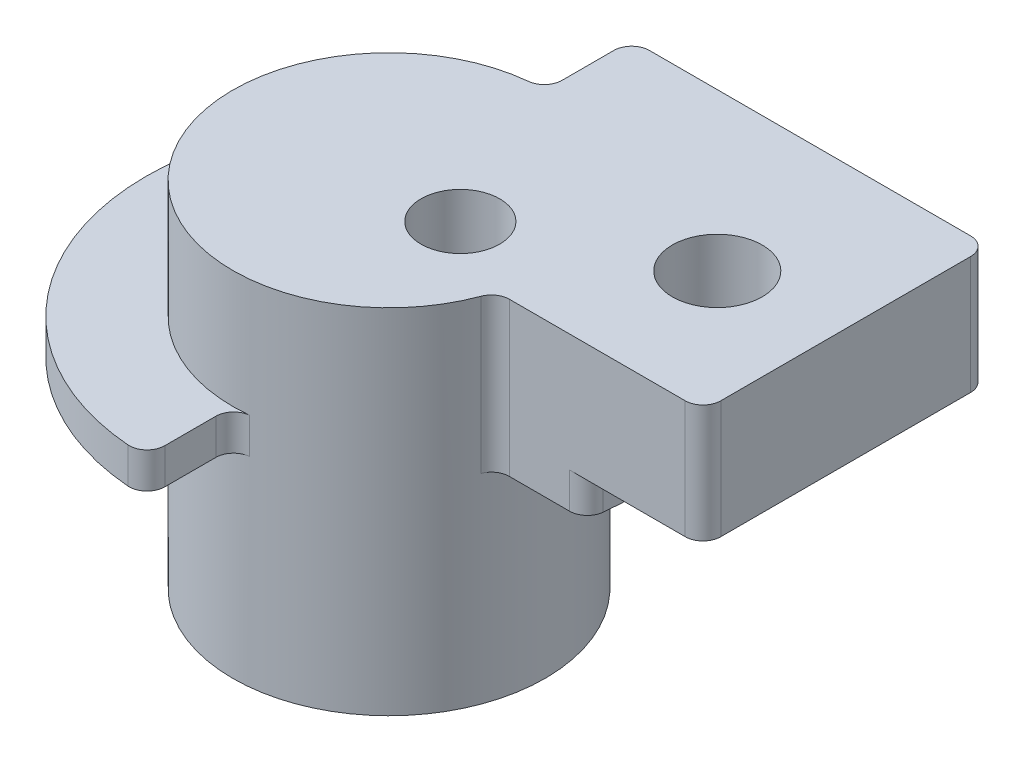
from build123d import *

# Parameters (mm, degrees)
SKETCH2_W           = 5.23875
SKETCH2_H           = 6.95
SKETCH2_W_2         = 1.5875
SKETCH2_H_2         = 3.845
SKETCH2_W_3         = 17.78
SKETCH3_R           = 11.338051479
CUT_EXTRUDE1_DEPTH  = 21.336
SKETCH5_R           = 1.75
CUT_EXTRUDE3_DEPTH  = 27.432
BOSS_EXTRUDE2_START = -5.23875
SKETCH5_3_R         = 2
BOSS_EXTRUDE2_DEPTH = 5.23875
FILLET1_R           = 0.79375
CUT_EXTRUDE4_START  = -14.224
CUT_EXTRUDE4_DEPTH  = 14.224
FILLET2_R           = 0.79375


with BuildPart() as part:
    # Sketch2 → Revolve2 (revolve)
    with BuildSketch(Plane(origin=(0, 0, 0), x_dir=(0, 1, 0), z_dir=(0, 0, 1)), mode=Mode.PRIVATE) as revolve2_sk:
        with Locations((-13.096875, 3.475)):
            Rectangle(SKETCH2_W, SKETCH2_H)
        with Locations((-9.68375, 3.475)):
            Rectangle(SKETCH2_W_2, SKETCH2_H)
        with Locations((-9.68375, 8.8725)):
            Rectangle(SKETCH2_W_2, SKETCH2_H_2)
        with Locations((0, 3.475)):
            Rectangle(SKETCH2_W_3, SKETCH2_H)
        with Locations((9.68375, 3.475)):
            Rectangle(SKETCH2_W_2, SKETCH2_H)
        with Locations((9.68375, 8.8725)):
            Rectangle(SKETCH2_W_2, SKETCH2_H_2)
        with Locations((13.096875, 3.475)):
            Rectangle(SKETCH2_W, SKETCH2_H)
    revolve(revolve2_sk.sketch.rotate(Axis((0, -15.71625, 0), (0, 1, 0)), 180), axis=Axis((0, -15.71625, 0), (0, 1, 0)))

    # Sketch3 → Cut-Extrude1 (cut)
    with BuildSketch(Plane(origin=(0, 0, 0), x_dir=(-1, 0, 0), z_dir=(0, 1, 0))):
        Circle(SKETCH3_R)
    extrude(amount=-CUT_EXTRUDE1_DEPTH, mode=Mode.SUBTRACT)

    # Sketch5 → Cut-Extrude3 (cut)
    with BuildSketch(Plane(origin=(0, 15.71625, 0), x_dir=(-1, 0, 0), z_dir=(0, 1, 0))):
        with Locations((-3.175, 0)):
            Circle(SKETCH5_R)
    extrude(amount=-CUT_EXTRUDE3_DEPTH, mode=Mode.SUBTRACT)

    # Sketch5<3> → Boss-Extrude2 (add)
    with BuildSketch(Plane(origin=(0, 15.71625, 0), x_dir=(-1, 0, 0), z_dir=(0, 1, 0)).offset(BOSS_EXTRUDE2_START)):
        with BuildLine():
            Line((-15.875, -10.795), (0, -10.795))
            Line((0, -10.795), (0, -6.95))
            ThreePointArc((0, -6.95), (-5.547172703, -4.187048483), (-6.683821886, 1.905))
            Line((-6.683821886, 1.905), (-15.875, 1.905))
            Line((-15.875, 1.905), (-15.875, -10.795))
        make_face()
        with Locations((-10.795, -3.81)):
            Circle(SKETCH5_3_R, mode=Mode.SUBTRACT)
    extrude(amount=BOSS_EXTRUDE2_DEPTH)

    # Fillet1
    # the kernel refuses this fillet: 0.79375 mm, written as the material it adds along each edge
    with BuildSketch(Plane(origin=(0, 10.4775, -6.95), x_dir=(-0.9986823309895368, 0, 0.051318629846335534), z_dir=(0, 1, 0))) as fillet1_piece_1:
        with BuildLine():
            CenterArc((0.754063117, -0.7927041), FILLET1_R, 92.941633047, 84.116733906)
            Line((-0.038640983, -0.751969938), (0, 0))
            ThreePointArc((0, 0), (0.356664477, -0.0091578), (0.713328955, 0))
        make_face()
    extrude(amount=5.23875)
    with BuildSketch(Plane(origin=(6.683821886, 9.041391923, 1.905), x_dir=(1, 0, 0), z_dir=(0, 1, 0))) as fillet1_piece_2:
        with BuildLine():
            CenterArc((0.574443231, -0.79375), FILLET1_R, 90, 69.603984808)
            ThreePointArc((-0.169543589, -0.51712268), (-0.079708314, -0.26022145), (0, 0))
            Line((0, 0), (0.574443231, 0))
        make_face()
    extrude(amount=6.674858077)
    # the kernel refuses this fillet: 0.79375 mm, written as the material it takes off along each edge
    with BuildSketch(Plane(origin=(0, 10.4775, -10.795), x_dir=(1, 0, 0), z_dir=(0, 1, 0))) as fillet1_2_piece_1:
        with BuildLine():
            CenterArc((FILLET1_R, -FILLET1_R), FILLET1_R, 90, 90)
            Line((0, -FILLET1_R), (0, 0))
            Line((0, 0), (FILLET1_R, 0))
        make_face()
    extrude(amount=7.223125, mode=Mode.SUBTRACT)
    with BuildSketch(Plane(origin=(15.875, 8.493125, 1.905), x_dir=(0, 0, -1), z_dir=(0, 1, 0)), Plane(origin=(15.875, 8.493125, -10.795), x_dir=(-1, 0, 0), z_dir=(0, 1, 0))) as fillet1_2_piece_2:
        with BuildLine():
            CenterArc((FILLET1_R, FILLET1_R), FILLET1_R, 180, 90)
            Line((0, FILLET1_R), (0, 0))
            Line((0, 0), (FILLET1_R, 0))
        make_face()
    extrude(amount=9.2075, mode=Mode.SUBTRACT)

    # Sketch6 → Cut-Extrude4 (cut)
    with BuildSketch(Plane(origin=(0, 10.4775, 0), x_dir=(-1, 0, 0), z_dir=(0, 1, 0)).offset(CUT_EXTRUDE4_START)):
        with BuildLine():
            ThreePointArc((-6.514278297, 2.42212268), (-3.966657748, 5.70684907), (0, 6.95))
            Line((0, 6.95), (0, 10.795))
            ThreePointArc((0, 10.795), (-6.927032193, 8.279387055), (-10.625582337, 1.905))
            Line((-10.625582337, 1.905), (-7.258265116, 1.905))
            ThreePointArc((-7.258265116, 1.905), (-6.805238557, 2.046978568), (-6.514278297, 2.42212268))
        make_face()
    extrude(amount=CUT_EXTRUDE4_DEPTH, mode=Mode.SUBTRACT)

    # Fillet2
    # the kernel refuses this fillet: 0.79375 mm, written as the material it adds along each edge
    with BuildSketch(Plane(origin=(0, 8.89, 6.95), x_dir=(0.9986823309895368, 0, -0.05131862984633391), z_dir=(0, 1, 0))) as fillet2_piece_1:
        with BuildLine():
            CenterArc((0.754063117, -0.7927041), FILLET2_R, 92.941633047, 84.116733906)
            Line((-0.038640983, -0.751969938), (0, 0))
            ThreePointArc((0, 0), (0.356664477, -0.0091578), (0.713328955, 0))
        make_face()
    extrude(amount=1.5875)
    # the kernel refuses this fillet: 0.79375 mm, written as the material it takes off along each edge
    with BuildSketch(Plane(origin=(0, 6.746443854, 10.795), x_dir=(0, 0, -1), z_dir=(0, 1, 0))) as fillet2_2_piece_1:
        with BuildLine():
            CenterArc((0.825297773, 0.79375), FILLET2_R, 175.447928579, 94.552071421)
            ThreePointArc((0.034051564, 0.856746032), (0.00851625, 0.428711229), (0, 0))
            Line((0, 0), (0.825297773, 0))
        make_face()
    extrude(amount=5.874612291, mode=Mode.SUBTRACT)
    with BuildSketch(Plane(origin=(10.625582337, 7.107567927, 1.905), x_dir=(-1, 0, 0), z_dir=(0, 1, 0))) as fillet2_2_piece_2:
        with BuildLine():
            CenterArc((0.686260177, -0.79375), FILLET2_R, 90, 83.620629792)
            ThreePointArc((-0.102574915, -0.705555556), (-0.057113988, -0.351930706), (0, 0))
            Line((0, 0), (0.686260177, 0))
        make_face()
    extrude(amount=3.369932073, mode=Mode.SUBTRACT)


solid = part.part
